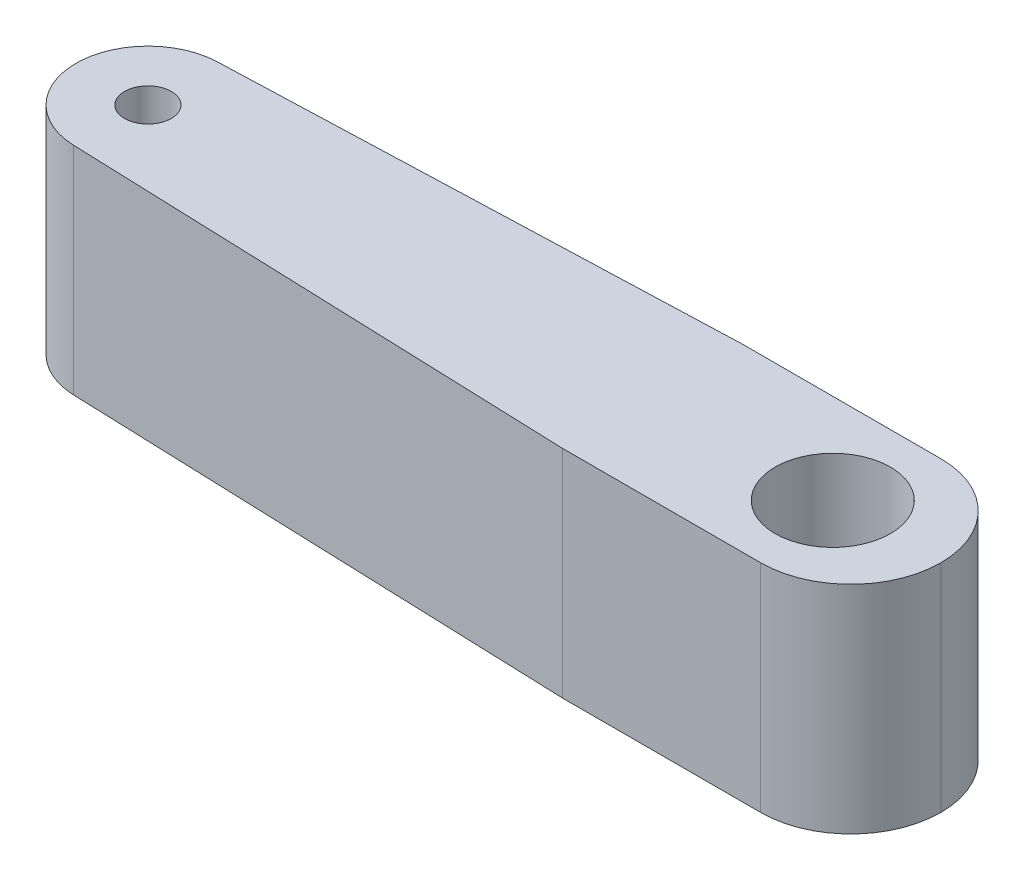
from build123d import *

# Parameters (mm, degrees)
SKETCH_1_W          = 25
SKETCH_1_H          = 5
EXTRUDE_1_DEPTH     = 6
SKETCH_2_R          = 1.6
SKETCH_2_R_2        = 0.65
CUT_EXTRUDE_1_DEPTH = 10
FILLET_1_R          = 2.5
CUT_EXTRUDE_2_DEPTH = 7


with BuildPart() as part:
    # 草图1 → 凸台-拉伸1 (new body)
    with BuildSketch(Plane(origin=(0, 0, 0), x_dir=(1, 0, 0), z_dir=(0, 1, 0))):
        Rectangle(SKETCH_1_W, SKETCH_1_H)
    extrude(amount=EXTRUDE_1_DEPTH)

    # 草图2 → 切除-拉伸1 (cut)
    with BuildSketch(Plane(origin=(0, 6, 0), x_dir=(1, 0, 0), z_dir=(0, 1, 0))):
        with Locations(Location((9.5, 0, 0), (0, 0, 270))):
            Circle(SKETCH_2_R)
        with Locations(Location((-9.5, 0, 0), (0, 0, 270))):
            Circle(SKETCH_2_R_2)
    extrude(amount=-CUT_EXTRUDE_1_DEPTH, mode=Mode.SUBTRACT)

    # 圆角1
    fillet_1_edges = [part.edges().sort_by_distance(p)[0] for p in [
        (12.5, 3, 2.5),
        (12.5, 3, -2.5),
        (-12.5, 3, 2.5),
        (-12.5, 3, -2.5),
    ]]
    fillet(fillet_1_edges, radius=FILLET_1_R - 0.0001)  # a hair under: the kernel refuses the full size

    # 草图3 → 切除-拉伸2 (cut)
    with BuildSketch(Plane(origin=(0, 6, 0), x_dir=(1, 0, 0), z_dir=(0, 1, 0))):
        with BuildLine():
            Line((-9.571202172, 1.998732161), (4.5, 2.5))
            Line((4.5, 2.5), (-10, 2.5))
            ThreePointArc((-10, 2.5), (-11.767766953, 1.767766953), (-12.5, 0))
            ThreePointArc((-12.5, 0), (-11.767766953, -1.767766953), (-10, -2.5))
            Line((-10, -2.5), (4.5, -2.5))
            Line((4.5, -2.5), (-9.571202172, -1.998732161))
            ThreePointArc((-9.571202172, -1.998732161), (-11.5, 0), (-9.571202172, 1.998732161))
        make_face()
    extrude(amount=-CUT_EXTRUDE_2_DEPTH, mode=Mode.SUBTRACT)


with BuildPart() as cut_extrude_2_kept_piece:
    # of the separate pieces the step leaves, the one the design keeps (cut_extrude_2_pieces_kept)
    add(part.part.solids().sort_by_distance((4.5, 0, -2.5))[0])


solid = cut_extrude_2_kept_piece.part
